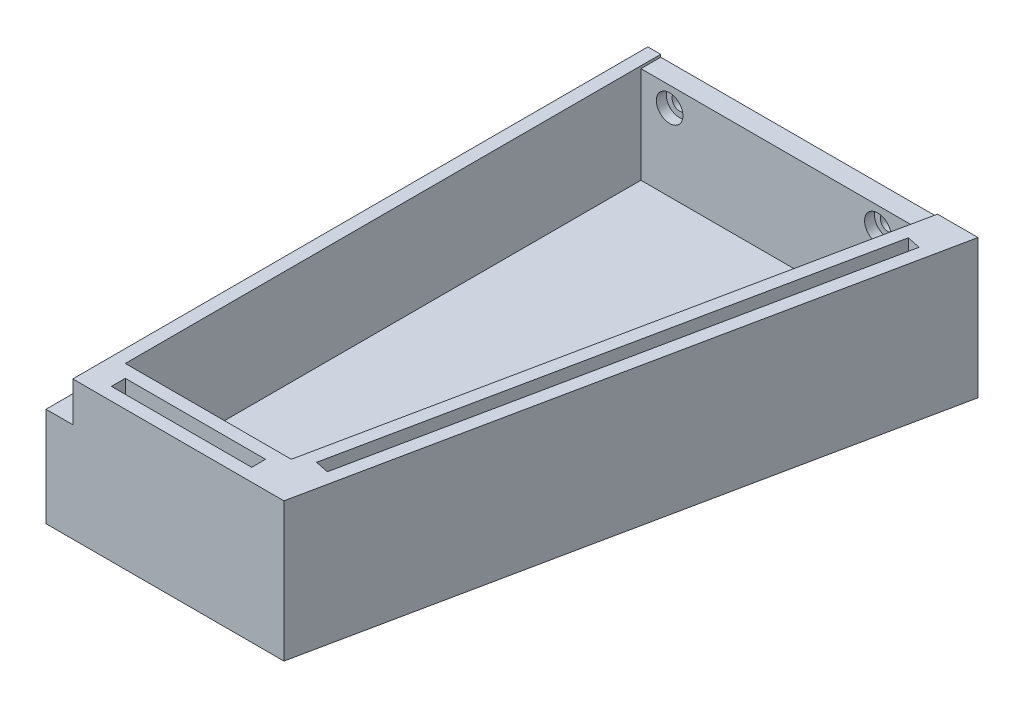
from build123d import *

# Parameters (mm, degrees)
BOSS_EXTRUDE1_DEPTH = 35
BOSS_EXTRUDE2_DEPTH = 10
SKETCH4_W           = 35.357177314
SKETCH4_H           = 3.5
CUT_EXTRUDE1_DEPTH  = 10
CUT_EXTRUDE2_DEPTH  = 0.625
CUT_EXTRUDE3_REACH  = 165.362
SKETCH6_R           = 1.9
SKETCH7_R           = 3.35
CUT_EXTRUDE4_DEPTH  = 2.5
LPATTERN1_COUNT     = 2
LPATTERN1_PITCH     = 52.5
SKETCH8_W           = 6.75
SKETCH8_H           = 145
CUT_EXTRUDE5_DEPTH  = 10


with BuildPart() as part:
    # Sketch1 → Boss-Extrude1 (new body)
    with BuildSketch(Plane(origin=(0, 0, 0), x_dir=(-1, 0, 0), z_dir=(0, 1, 0))):
        Polygon((16.563657866, 147.59508075), (-13.436342134, 2.59508075), (76.563657866, 2.59508075), (76.563657866, 147.59508075), align=None)
        Polygon((-2.190071172, 7.59508075), (24.706480552, 137.59508075), (66.563657866, 137.59508075), (66.563657866, 7.59508075), align=None, mode=Mode.SUBTRACT)
    extrude(amount=BOSS_EXTRUDE1_DEPTH)

    # Sketch3 → Boss-Extrude2 (add)
    with BuildSketch(Plane.XZ):
        Polygon((-76.563657866, 147.59508075), (-16.563657866, 147.59508075), (13.436342134, 2.59508075), (-76.563657866, 2.59508075), align=None)
    extrude(amount=-BOSS_EXTRUDE2_DEPTH)

    # Sketch4 → Cut-Extrude1 (cut)
    with BuildSketch(Plane(origin=(0, 35, 0), x_dir=(-1, 0, 0), z_dir=(0, 1, 0))):
        with Locations((45.635069209, 142.59508075)):
            Rectangle(SKETCH4_W, SKETCH4_H)
        Polygon((-4.714199322, 11.436145326), (20.865415976, 135.0709526), (17.438004507, 135.780072214), (-8.141610791, 12.145264941), align=None)
    extrude(amount=-CUT_EXTRUDE1_DEPTH, mode=Mode.SUBTRACT)

    # Sketch5 → Cut-Extrude2 (cut)
    with BuildSketch(Plane(origin=(0, 35, -3.02991925), x_dir=(1, 0, 0), z_dir=(0, -1, 0))):
        Polygon((2.190071172, 10.625), (-66.563657866, 10.625), (-66.563657866, 5.625), (3.224553931, 5.625), align=None)
    extrude(amount=CUT_EXTRUDE2_DEPTH, mode=Mode.SUBTRACT)

    # Sketch6 → Cut-Extrude3 (cut, up to next)
    with BuildSketch(Plane.XY.offset(7.59508075), mode=Mode.PRIVATE) as cut_extrude3_sk1:
        with Locations((-59.313657866, 29.375)):
            Circle(SKETCH6_R)
    cut_extrude3_tool1 = extrude(cut_extrude3_sk1.sketch, amount=-CUT_EXTRUDE3_REACH, mode=Mode.PRIVATE) & part.part
    cut_extrude3 = cut_extrude3_tool1.solids().sort_by_distance((-59.313658, 29.375, 7.595081))[0]
    add(cut_extrude3, mode=Mode.SUBTRACT)

    # Sketch7 → Cut-Extrude4 (cut)
    with BuildSketch(Plane.XY.offset(7.59508075)):
        with Locations((-59.313657866, 29.375)):
            Circle(SKETCH7_R)
    cut_extrude4 = extrude(amount=-CUT_EXTRUDE4_DEPTH, mode=Mode.SUBTRACT)

    # LPattern1: Cut-Extrude3, Cut-Extrude4 ×2
    with Locations(*[(i * LPATTERN1_PITCH, 0, 0) for i in range(1, LPATTERN1_COUNT)]):
        add(cut_extrude3, mode=Mode.SUBTRACT)
        add(cut_extrude4, mode=Mode.SUBTRACT)

    # Sketch8 → Cut-Extrude5 (cut)
    with BuildSketch(Plane(origin=(0, 35, 0), x_dir=(-1, 0, 0), z_dir=(0, 1, 0))):
        with Locations((73.188657866, 75.09508075)):
            Rectangle(SKETCH8_W, SKETCH8_H)
    extrude(amount=-CUT_EXTRUDE5_DEPTH, mode=Mode.SUBTRACT)


solid = part.part
